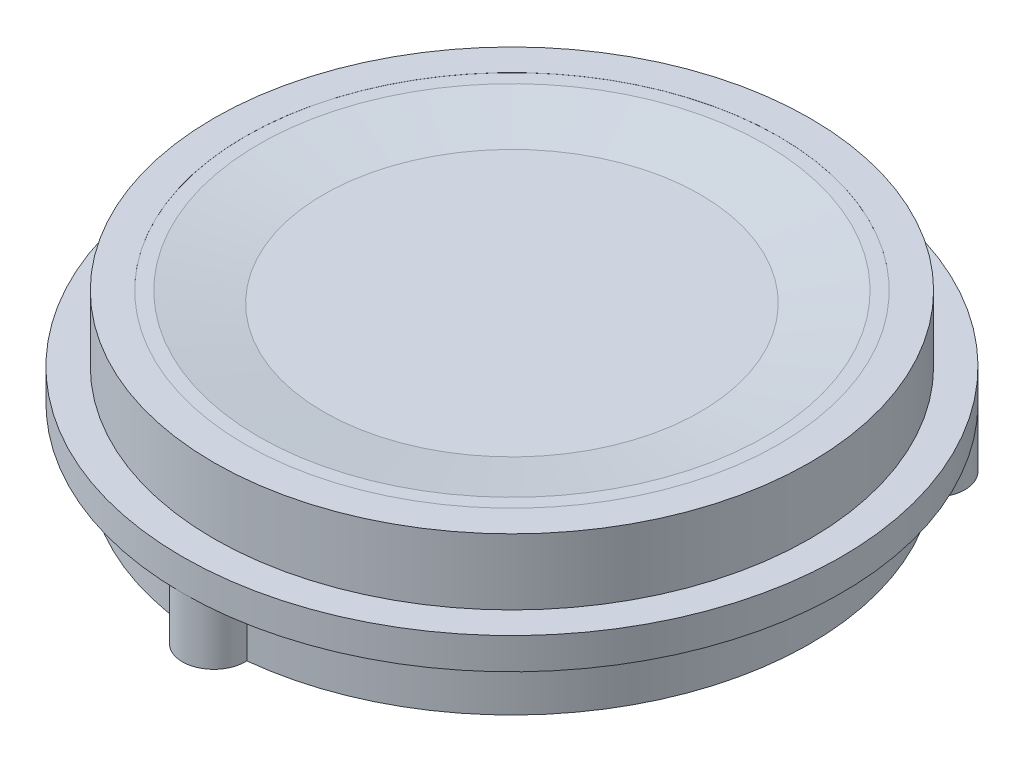
from build123d import *

# Parameters (mm, degrees)
SKETCH_1_R               = 9.5
EXTRUDE_1_DEPTH          = 5
EXTRUDE_START            = -2.1
SKETCH_2_R               = 10.5
EXTRUDE_2_DEPTH          = 1
SKETCH_5_R               = 1
EXTRUDE_3_DEPTH          = 1.9
PATTERN_CIRCULAR_1_COUNT = 2
PATTERN_CIRCULAR_1_ANGLE = 135
PATTERN_CIRCULAR_2_DEPTH = 1.9
CUT_EXTRUDE_1_DEPTH      = 3
SKETCH_8_W               = 8
SKETCH_8_H               = 3
EXTRUDE_4_DEPTH          = 4
SKETCH_9_W               = 0.371015219
SKETCH_9_H               = 0.371763235
CUT_EXTRUDE_2_DEPTH      = 3
SKETCH_10_W              = 0.3
SKETCH_10_H              = 0.3
EXTRUDE_5_DEPTH          = 2.5
PATTERN_LINEAR_1_COUNT   = 6
PATTERN_LINEAR_1_PITCH   = 1
CHAMFER_2_SIZE           = 0.1
CUT_EXTRUDE_START        = -0.5
SKETCH_12_R              = 9
CUT_EXTRUDE_3_DEPTH      = 2.5


# Read off the part's stored shape, not the designer's step: 阵列(圆周)2
with BuildPart() as part:
    # 草图1 → 凸台-拉伸1 (new body)
    with BuildSketch(Plane(origin=(0, 0, 0), x_dir=(1, 0, 0), z_dir=(0, 1, 0))):
        with Locations(Location((0, 0, 0), (0, 0, 270))):
            Circle(SKETCH_1_R)
    extrude(amount=EXTRUDE_1_DEPTH)

    # 草图2 → 凸台-拉伸2 (add)
    with BuildSketch(Plane(origin=(0, 5, 0), x_dir=(1, 0, 0), z_dir=(0, 1, 0)).offset(EXTRUDE_START)):
        with Locations(Location((0, 0, 0), (0, 0, 270))):
            Circle(SKETCH_2_R)
    extrude(amount=-EXTRUDE_2_DEPTH)

    # 草图4 → 切除-旋转1 (revolve, cut)
    with BuildSketch(Plane.XY, mode=Mode.PRIVATE) as cut_revolve_1_sk:
        Polygon((-6, 4.647888156), (-8.069931191, 4.997348238), (-8.5, 4.997348238), (-8.5, 5), (0, 5), (0, 4.647888156), align=None)
    revolve(cut_revolve_1_sk.sketch.rotate(Axis((0, -1.517418631, 0), (0, 1, 0)), 270), axis=Axis((0, -1.517418631, 0), (0, 1, 0)), mode=Mode.SUBTRACT)

    # 草图5 → 凸台-拉伸3 (add)
    with BuildSketch(Plane.XZ):
        with Locations((0, 9.5)):
            Circle(SKETCH_5_R)
    extrude_3 = extrude(amount=-EXTRUDE_3_DEPTH)

    # 阵列(圆周)1: 凸台-拉伸3 ×2 about axis
    pattern_circular_1_axis = Axis((0, -1.474680135, 0), (0, 1, 0))
    for i in range(1, PATTERN_CIRCULAR_1_COUNT):
        add(extrude_3.rotate(pattern_circular_1_axis, i * PATTERN_CIRCULAR_1_ANGLE / (PATTERN_CIRCULAR_1_COUNT - 1)))

    # 阵列(圆周)2 outline → 阵列(圆周)2 (add)
    with BuildSketch(Plane(origin=(0, 0, 0), x_dir=(1, 0, 0), z_dir=(0, 1, 0))):
        with BuildLine():
            ThreePointArc((-5.974171545, 7.386425005), (-7.424621202, 7.424621202), (-7.386425005, 5.974171545))
            ThreePointArc((-7.386425005, 5.974171545), (-6.717514421, 6.717514421), (-5.974171545, 7.386425005))
        make_face()
    extrude(amount=PATTERN_CIRCULAR_2_DEPTH)

    # 草图7 → 切除-拉伸1 (cut)
    with BuildSketch(Plane.XZ):
        with BuildLine():
            Line((4.9, -5.107989032), (-4.9, -5.107989032))
            ThreePointArc((-4.9, -5.107989032), (-5.607106781, -4.815095813), (-5.9, -4.107989032))
            Line((-5.9, -4.107989032), (-5.9, -1.307989032))
            ThreePointArc((-5.9, -1.307989032), (-5.607106781, -0.600882251), (-4.9, -0.307989032))
            Line((-4.9, -0.307989032), (4.9, -0.307989032))
            ThreePointArc((4.9, -0.307989032), (5.607106781, -0.600882251), (5.9, -1.307989032))
            Line((5.9, -1.307989032), (5.9, -4.107989032))
            ThreePointArc((5.9, -4.107989032), (5.607106781, -4.815095813), (4.9, -5.107989032))
        make_face()
    extrude(amount=-CUT_EXTRUDE_1_DEPTH, mode=Mode.SUBTRACT)

    # 草图8 → 凸台-拉伸4 (add)
    with BuildSketch(Plane.XZ.offset(-3)):
        with Locations((0, -2.707989032)):
            Rectangle(SKETCH_8_W, SKETCH_8_H)
    extrude(amount=EXTRUDE_4_DEPTH)

    # 草图9 → 切除-拉伸2 (cut)
    with BuildSketch(Plane.XZ.offset(1)):
        Polygon((3.065007513, -1.6503828), (-3.065007513, -1.6503828), (-3.065007513, -2.203803593), (-3.628984781, -2.203803593), (-3.628984781, -2.769586289), (-3.276529987, -2.769586289), (-3.276529987, -3.699579446), (3.276529987, -3.699579446), (3.276529987, -2.769586289), (3.628984781, -2.769586289), (3.628984781, -2.203803593), (3.065007513, -2.203803593), align=None)
        with Locations((-3.81449239, -4.022107415)):
            Rectangle(SKETCH_9_W, SKETCH_9_H)
        with Locations((3.81449239, -4.022107415)):
            Rectangle(SKETCH_9_W, SKETCH_9_H)
    extrude(amount=-CUT_EXTRUDE_2_DEPTH, mode=Mode.SUBTRACT)

    # 草图10 → 凸台-拉伸5 (add)
    with BuildSketch(Plane.XZ.offset(-2)):
        with Locations((-2.484856063, -2.377128525)):
            Rectangle(SKETCH_10_W, SKETCH_10_H)
    extrude_5 = extrude(amount=EXTRUDE_5_DEPTH)

    # 阵列(线性)1: 凸台-拉伸5 ×6
    with Locations(*[(i * PATTERN_LINEAR_1_PITCH, 0, 0) for i in range(1, PATTERN_LINEAR_1_COUNT)]):
        add(extrude_5)

    # 倒角2
    chamfer_2_edges = [part.edges().sort_by_distance(p)[0] for p in [
        (-2.634856063, -0.5, -2.377128525),
        (-2.484856063, -0.5, -2.527128525),
        (-2.334856063, -0.5, -2.377128525),
        (-2.484856063, -0.5, -2.227128525),
        (-1.634856063, -0.5, -2.377128525),
        (-1.484856063, -0.5, -2.527128525),
        (-1.334856063, -0.5, -2.377128525),
        (-1.484856063, -0.5, -2.227128525),
        (-0.634856063, -0.5, -2.377128525),
        (-0.484856063, -0.5, -2.527128525),
        (-0.334856063, -0.5, -2.377128525),
        (-0.484856063, -0.5, -2.227128525),
        (0.365143937, -0.5, -2.377128525),
        (0.515143937, -0.5, -2.527128525),
        (0.665143937, -0.5, -2.377128525),
        (0.515143937, -0.5, -2.227128525),
        (1.365143937, -0.5, -2.377128525),
        (1.515143937, -0.5, -2.527128525),
        (1.665143937, -0.5, -2.377128525),
        (1.515143937, -0.5, -2.227128525),
        (2.365143937, -0.5, -2.377128525),
        (2.515143937, -0.5, -2.527128525),
        (2.665143937, -0.5, -2.377128525),
        (2.515143937, -0.5, -2.227128525),
    ]]
    chamfer(chamfer_2_edges, length=CHAMFER_2_SIZE)

    # 草图12 → 切除-拉伸3 (cut)
    with BuildSketch(Plane.XZ.offset(CUT_EXTRUDE_START)):
        with Locations(Location((0, 0, 0), (0, 0, 270))):
            Circle(SKETCH_12_R)
        with BuildLine():
            Line((5.9, -4.107989032), (5.9, -1.307989032))
            ThreePointArc((5.9, -1.307989032), (5.607106781, -0.600882251), (4.9, -0.307989032))
            Line((4.9, -0.307989032), (-4.9, -0.307989032))
            ThreePointArc((-4.9, -0.307989032), (-5.607106781, -0.600882251), (-5.9, -1.307989032))
            Line((-5.9, -1.307989032), (-5.9, -4.107989032))
            ThreePointArc((-5.9, -4.107989032), (-5.607106781, -4.815095813), (-4.9, -5.107989032))
            Line((-4.9, -5.107989032), (4.9, -5.107989032))
            ThreePointArc((4.9, -5.107989032), (5.607106781, -4.815095813), (5.9, -4.107989032))
        make_face(mode=Mode.SUBTRACT)
    extrude(amount=-CUT_EXTRUDE_3_DEPTH, mode=Mode.SUBTRACT)


solid = part.part
